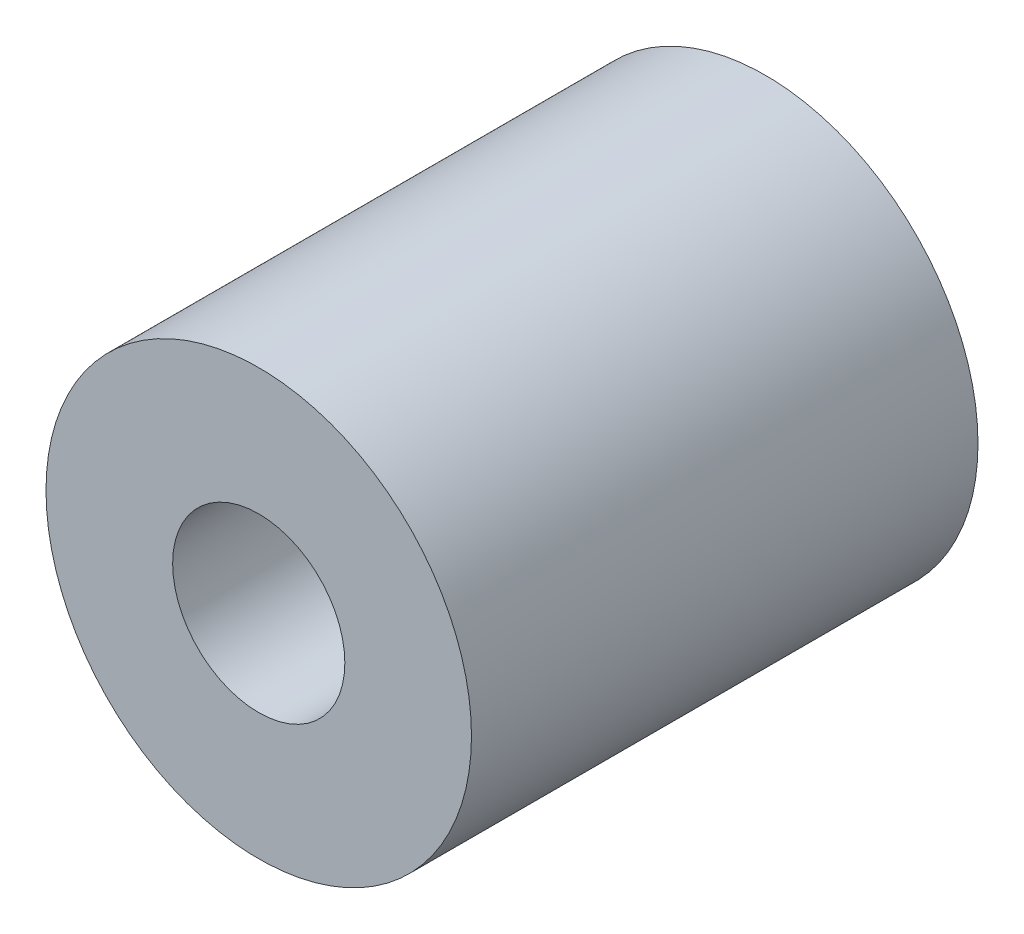
from build123d import *

# Parameters (mm, degrees)
SKETCH1_W           = 3.125
SKETCH1_H           = 3.75
SKETCH2_R           = 5.25
SKETCH2_R_2         = 2.125
BOSS_EXTRUDE1_DEPTH = 9.25
SKETCH3_R           = 5.25
SKETCH3_R_2         = 3
CUT_EXTRUDE1_DEPTH  = 0.5


with BuildPart() as part:
    # Sketch1 → Revolve1 (revolve)
    with BuildSketch(Plane(origin=(0, 0, 0), x_dir=(1, 0, 0), z_dir=(0, 1, 0))):
        with Locations((3.6875, -1.875)):
            Rectangle(SKETCH1_W, SKETCH1_H)
    revolve(axis=Axis((0, 0, 0), (0, 0, 1)))

    # Sketch2 → Boss-Extrude1 (add)
    with BuildSketch(Plane.XY.offset(3.75)):
        Circle(SKETCH2_R)
        Circle(SKETCH2_R_2, mode=Mode.SUBTRACT)
    extrude(amount=BOSS_EXTRUDE1_DEPTH)

    # Sketch3 → Cut-Extrude1 (cut)
    with BuildSketch(Plane(origin=(0, 0, 0), x_dir=(-1, 0, 0), z_dir=(0, 0, -1))):
        Circle(SKETCH3_R)
        Circle(SKETCH3_R_2, mode=Mode.SUBTRACT)
    extrude(amount=-CUT_EXTRUDE1_DEPTH, mode=Mode.SUBTRACT)


solid = part.part
